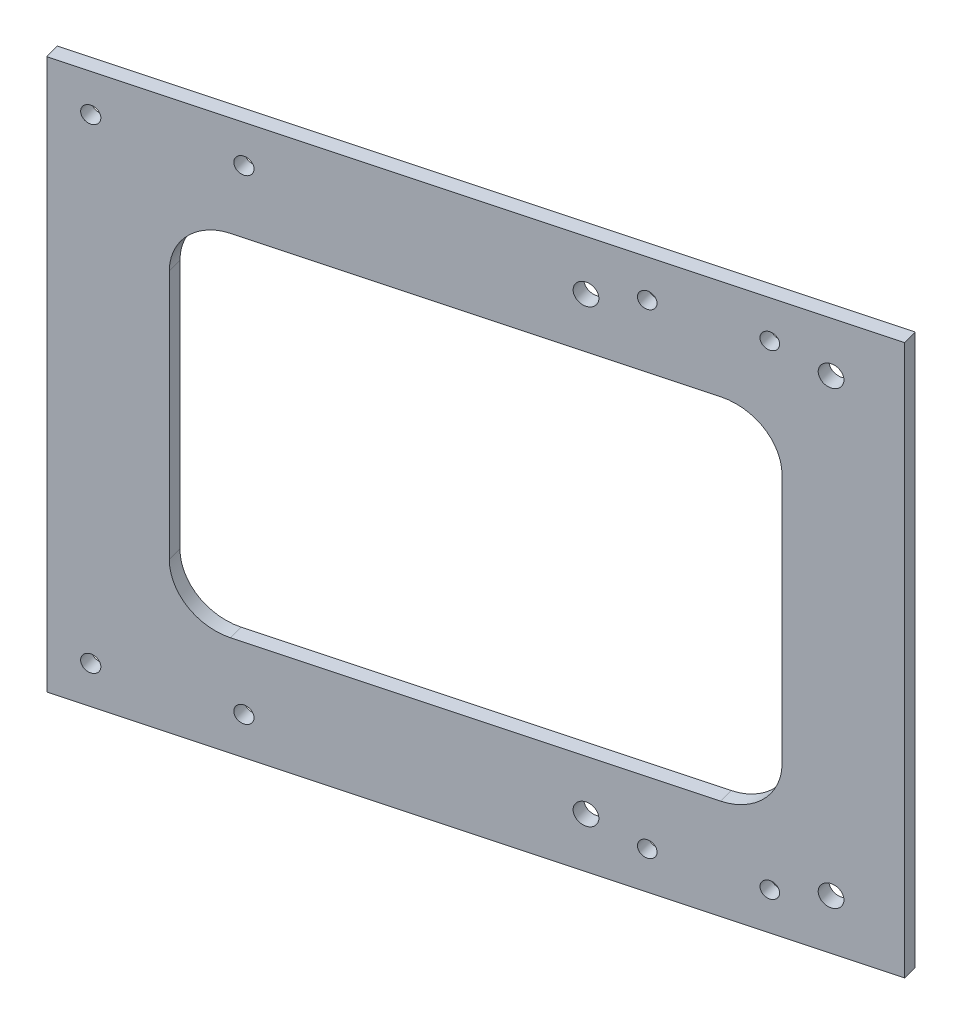
from build123d import *

# Parameters (mm, degrees)
SKETCH2_W      = 140
SKETCH2_H      = 110
SKETCH2_R      = 1.6
SKETCH2_R_2    = 2.1
EXTRUDE1_DEPTH = 3


with BuildPart() as part:
    # Sketch2 → Extrude1 (new body)
    with BuildSketch(Plane(origin=(-8.535929163, 0, -31.856521324), x_dir=(0.9659258262890755, 0, -0.2588190451024938), z_dir=(0.2588190451024938, 0, 0.9659258262890756))):
        with Locations((118.519484346, 45.004395502)):
            Rectangle(SKETCH2_W, SKETCH2_H)
        with Locations((166.519484346, 92.504395502)):
            Circle(SKETCH2_R, mode=Mode.SUBTRACT)
        with Locations((146.519484346, 92.504395502)):
            Circle(SKETCH2_R, mode=Mode.SUBTRACT)
        with Locations((146.519484346, -2.495604498)):
            Circle(SKETCH2_R, mode=Mode.SUBTRACT)
        with Locations((166.519484346, -2.495604498)):
            Circle(SKETCH2_R, mode=Mode.SUBTRACT)
        with Locations((176.519484346, 0.004395502)):
            Circle(SKETCH2_R_2, mode=Mode.SUBTRACT)
        with Locations((136.519484346, 0.004395502)):
            Circle(SKETCH2_R_2, mode=Mode.SUBTRACT)
        with Locations((176.519484346, 90.004395502)):
            Circle(SKETCH2_R_2, mode=Mode.SUBTRACT)
        with Locations((136.519484346, 90.004395502)):
            Circle(SKETCH2_R_2, mode=Mode.SUBTRACT)
        with BuildLine():
            Line((78.519484346, 80.004395502), (158.519484346, 80.004395502))
            ThreePointArc((158.519484346, 80.004395502), (165.590552158, 77.075463314), (168.519484346, 70.004395502))
            Line((168.519484346, 70.004395502), (168.519484346, 20.004395502))
            ThreePointArc((168.519484346, 20.004395502), (165.590552158, 12.93332769), (158.519484346, 10.004395502))
            Line((158.519484346, 10.004395502), (78.519484346, 10.004395502))
            ThreePointArc((78.519484346, 10.004395502), (71.448416534, 12.93332769), (68.519484346, 20.004395502))
            Line((68.519484346, 20.004395502), (68.519484346, 70.004395502))
            ThreePointArc((68.519484346, 70.004395502), (71.448416534, 77.075463314), (78.519484346, 80.004395502))
        make_face(mode=Mode.SUBTRACT)
        with BuildLine():
            ThreePointArc((54.043190493, -2.495604498), (55.693190493, -4.145604498), (57.343190493, -2.495604498))
            ThreePointArc((57.343190493, -2.495604498), (55.693190493, -0.845604498), (54.043190493, -2.495604498))
        make_face(mode=Mode.SUBTRACT)
        with BuildLine():
            ThreePointArc((79.043190493, -2.495604498), (80.693190493, -4.145604498), (82.343190493, -2.495604498))
            ThreePointArc((82.343190493, -2.495604498), (80.693190493, -0.845604498), (79.043190493, -2.495604498))
        make_face(mode=Mode.SUBTRACT)
        with BuildLine():
            ThreePointArc((79.043190493, 92.504395502), (80.693190493, 90.854395502), (82.343190493, 92.504395502))
            ThreePointArc((82.343190493, 92.504395502), (80.693190493, 94.154395502), (79.043190493, 92.504395502))
        make_face(mode=Mode.SUBTRACT)
        with BuildLine():
            ThreePointArc((54.043190493, 92.504395502), (55.693190493, 90.854395502), (57.343190493, 92.504395502))
            ThreePointArc((57.343190493, 92.504395502), (55.693190493, 94.154395502), (54.043190493, 92.504395502))
        make_face(mode=Mode.SUBTRACT)
    extrude(amount=EXTRUDE1_DEPTH)


solid = part.part
